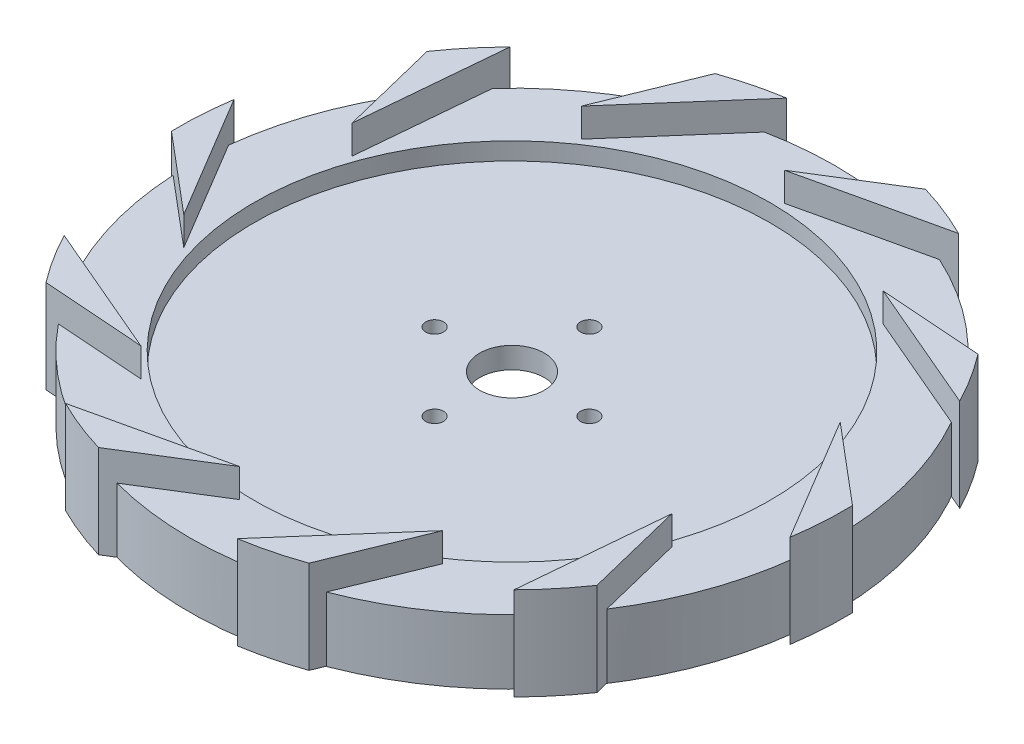
from build123d import *

# Parameters (mm, degrees)
GUIDE_START        = 3.429
GUIDE_VANES_DEPTH  = 18.288
CIRPATTERN4_COUNT  = 10
SKETCH5_R          = 60.325
HOLLOW_OUT_DEPTH   = 5.08
SKETCH6_R          = 6.35
CUT_EXTRUDE1_DEPTH = 93.42824842
SKETCH7_R          = 1.7526
CUT_EXTRUDE2_DEPTH = 93.42824842
CIRPATTERN5_COUNT  = 4


with BuildPart() as part:
    # Sketch3 → Body (revolve)
    with BuildSketch(Plane.XY):
        Polygon((-63.5, 16.0734375), (-50.8, 16.0734375), (-50.8, 12.633854167), (0, 12.633854167), (0, 3.3734375), (-63.5, 3.3734375), align=None)
    revolve(axis=Axis((0, 0, 0), (0, 1, 0)))

    # Sketch4 → Guide Vanes (add)
    with BuildSketch(Plane(origin=(0, 0, 0), x_dir=(1, 0, 0), z_dir=(0, 1, 0)).offset(GUIDE_START)):
        with BuildLine():
            Line((1.553349961, 52.076946284), (18.68699888, 62.727592909))
            ThreePointArc((18.68699888, 62.727592909), (24.16847964, 60.826305421), (29.460054596, 58.447070265))
            Line((29.460054596, 58.447070265), (1.553349961, 52.076946284))
        make_face()
    guide_vanes = extrude(amount=GUIDE_VANES_DEPTH)

    # CirPattern4: Guide Vanes ×10 about axis
    cirpattern4_axis = Axis((0, 16.0734375, 0), (0, -1, 0))
    for i in range(1, CIRPATTERN4_COUNT):
        add(guide_vanes.rotate(cirpattern4_axis, i * 360 / CIRPATTERN4_COUNT))

    # Sketch5 → Hollow out (cut)
    with BuildSketch(Plane.XZ.offset(-3.3734375)):
        Circle(SKETCH5_R)
    extrude(amount=-HOLLOW_OUT_DEPTH, mode=Mode.SUBTRACT)

    # Sketch6 → Cut-Extrude1 (cut, through all)
    with BuildSketch(Plane(origin=(0, 12.633854167, 0), x_dir=(1, 0, 0), z_dir=(0, 1, 0))):
        Circle(SKETCH6_R)
    extrude(amount=-CUT_EXTRUDE1_DEPTH, mode=Mode.SUBTRACT)

    # Sketch7 → Cut-Extrude2 (cut, through all)
    with BuildSketch(Plane(origin=(0, 12.633854167, 0), x_dir=(1, 0, 0), z_dir=(0, 1, 0))):
        with Locations((0, 15.24)):
            Circle(SKETCH7_R)
    cut_extrude2 = extrude(amount=-CUT_EXTRUDE2_DEPTH, mode=Mode.SUBTRACT)

    # CirPattern5: Cut-Extrude2 ×4 about axis
    cirpattern5_axis = Axis((0, 12.633854167, 0), (0, 1, 0))
    for i in range(1, CIRPATTERN5_COUNT):
        add(cut_extrude2.rotate(cirpattern5_axis, i * 360 / CIRPATTERN5_COUNT), mode=Mode.SUBTRACT)


solid = part.part
